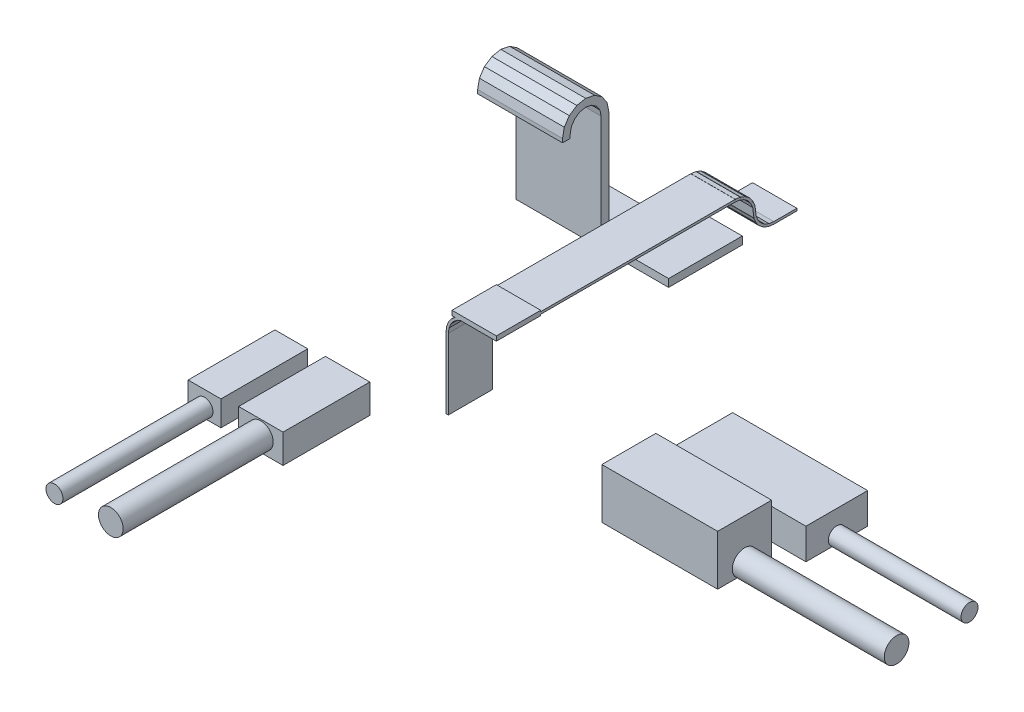
from build123d import *

# Parameters (mm, degrees)
SKETCH1_W                   = 8.5
SKETCH1_H                   = 6.5
PLUG_USBC_DEPTH             = 22.5
SKETCH2_R                   = 2.2
CABLE_USBC_DEPTH            = 39.4
SKETCH3_W                   = 11.5
SKETCH3_H                   = 7.5
PLUG_HDMI_DEPTH             = 22.5
SKETCH4_R                   = 3.2
CABLE_HDMI_DEPTH            = 39.4
SKETCH5_W                   = 14
SKETCH5_H                   = 13
PLUG_ETH_DEPTH              = 30
SKETCH6_R                   = 3.2
CABLE_ETH_DEPTH             = 39.9
SKETCH7_W                   = 16
SKETCH7_H                   = 8
PLUG_USBA_DEPTH             = 35
SKETCH8_R                   = 2.2
CABLE_USBA_DEPTH            = 34.9
SKETCH9_W                   = 6
SKETCH9_H                   = 0.6
RIBBON_0_DEPTH              = 11.5
RIBBON_1_DEPTH              = 11.5
RIBBON_2_DEPTH              = 11.5
RIBBON_3_DEPTH              = 11.5
RIBBON_4_DEPTH              = 11.5
RIBBON_5_DEPTH              = 11.5
RIBBON_6_DEPTH              = 11.5
RIBBON_7_DEPTH              = 11.5
RIBBON_8_DEPTH              = 11.5
RIBBON_9_DEPTH              = 11.5
RIBBON_10_DEPTH             = 11.5
RIBBON_11_DEPTH             = 11.5
RIBBON_12_DEPTH             = 11.5
SKETCH22_W                  = 56.15
SKETCH22_H                  = 0.6
RIBBON_13_DEPTH             = 11.5
SKETCH23_W                  = 11.5
SKETCH23_H                  = 11.5
RIBBON_FOLD_DEPTH           = 1.2
SKETCH24_W                  = 2
SKETCH24_H                  = 0.6
RIBBON_14_DEPTH             = 11.5
RIBBON_15_DEPTH             = 11.5
RIBBON_16_DEPTH             = 11.5
RIBBON_17_DEPTH             = 11.5
RIBBON_18_DEPTH             = 11.5
RIBBON_19_DEPTH             = 11.5
RIBBON_20_DEPTH             = 11.5
SKETCH31_W                  = 0.6
SKETCH31_H                  = 18.39
RIBBON_21_DEPTH             = 11.5
SKETCH32_W                  = 10
SKETCH32_H                  = 6
JUMPERS_WINDOW_DEPTH        = 2
SKETCH33_W                  = 39.5
SKETCH33_H                  = 13.1
JUMPERS_ACROSS_DEPTH        = 2
SKETCH34_W                  = 2
SKETCH34_H                  = 29.7
JUMPERS_RISE_DEPTH          = 22
JUMPERS_HAIRPIN_DEPTH       = 22
SKETCH36_W                  = 2
SKETCH36_H                  = 0.99
JUMPERS_INTO_HOUSINGS_DEPTH = 22


with BuildPart() as part:
    # Sketch1 → Plug usbc (new body)
    with BuildSketch(Plane.XY.offset(93)):
        with Locations((-43.8, -14.8)):
            Rectangle(SKETCH1_W, SKETCH1_H)
    extrude(amount=PLUG_USBC_DEPTH)

    # Sketch2 → Cable usbc (add)
    with BuildSketch(Plane.XY.offset(115)):
        with Locations((-43.8, -15.5)):
            Circle(SKETCH2_R)
    extrude(amount=CABLE_USBC_DEPTH)


with BuildPart() as body_2:
    # Sketch3 → Plug hdmi (new body)
    with BuildSketch(Plane.XY.offset(93)):
        with Locations((-29.2, -14.7)):
            Rectangle(SKETCH3_W, SKETCH3_H)
    extrude(amount=PLUG_HDMI_DEPTH)

    # Sketch4 → Cable hdmi (add)
    with BuildSketch(Plane.XY.offset(115)):
        with Locations((-29.2, -14.5)):
            Circle(SKETCH4_R)
    extrude(amount=CABLE_HDMI_DEPTH)


with BuildPart() as body_3:
    # Sketch5 → Plug eth (new body)
    with BuildSketch(Plane(origin=(33, 0, 0), x_dir=(0, 0, -1), z_dir=(1, 0, 0))):
        with Locations((-82.3, -9.6)):
            Rectangle(SKETCH5_W, SKETCH5_H)
    extrude(amount=PLUG_ETH_DEPTH)

    # Sketch6 → Cable eth (add)
    with BuildSketch(Plane(origin=(62.5, 0, 0), x_dir=(0, 0, -1), z_dir=(1, 0, 0))):
        with Locations((-82.3, -13.5)):
            Circle(SKETCH6_R)
    extrude(amount=CABLE_ETH_DEPTH)


with BuildPart() as body_4:
    # Sketch7 → Plug usba (new body)
    with BuildSketch(Plane(origin=(33, 0, 0), x_dir=(0, 0, -1), z_dir=(1, 0, 0))):
        with Locations((-63.4, -12.4)):
            Rectangle(SKETCH7_W, SKETCH7_H)
    extrude(amount=PLUG_USBA_DEPTH)

    # Sketch8 → Cable usba (add)
    with BuildSketch(Plane(origin=(67.5, 0, 0), x_dir=(0, 0, -1), z_dir=(1, 0, 0))):
        with Locations((-63.4, -14.5)):
            Circle(SKETCH8_R)
    extrude(amount=CABLE_USBA_DEPTH)


with BuildPart() as body_5:
    # Sketch9 → Ribbon 0 (new body)
    with BuildSketch(Plane(origin=(-5.35, 0, 0), x_dir=(0, 0, -1), z_dir=(1, 0, 0))):
        with Locations((-14.9, 2)):
            Rectangle(SKETCH9_W, SKETCH9_H)
    extrude(amount=RIBBON_0_DEPTH)

    # Sketch10 → Ribbon 1 (add)
    with BuildSketch(Plane(origin=(-5.35, 0, 0), x_dir=(0, 0, -1), z_dir=(1, 0, 0))):
        Polygon((-17.939157858, 1.702566542), (-19.233253083, 1.87293741), (-19.154937368, 2.467804327), (-17.860842142, 2.297433458), align=None)
    extrude(amount=RIBBON_1_DEPTH)

    # Sketch11 → Ribbon 2 (add)
    with BuildSketch(Plane(origin=(-5.35, 0, 0), x_dir=(0, 0, -1), z_dir=(1, 0, 0))):
        Polygon((-19.308900255, 1.893207009), (-20.51480503, 2.392709121), (-20.28519497, 2.947036841), (-19.079290196, 2.447534728), align=None)
    extrude(amount=RIBBON_2_DEPTH)

    # Sketch12 → Ribbon 3 (add)
    with BuildSketch(Plane(origin=(-5.35, 0, 0), x_dir=(0, 0, -1), z_dir=(1, 0, 0))):
        Polygon((-20.582628429, 2.431866979), (-21.618162335, 3.226460092), (-21.252905477, 3.702472096), (-20.217371571, 2.907878983), align=None)
    extrude(amount=RIBBON_3_DEPTH)

    # Sketch13 → Ribbon 4 (add)
    with BuildSketch(Plane(origin=(-5.35, 0, 0), x_dir=(0, 0, -1), z_dir=(1, 0, 0))):
        Polygon((-21.673539908, 3.281837665), (-22.468133021, 4.317371571), (-21.992121017, 4.682628429), (-21.197527904, 3.647094523), align=None)
    extrude(amount=RIBBON_4_DEPTH)

    # Sketch14 → Ribbon 5 (add)
    with BuildSketch(Plane(origin=(-5.35, 0, 0), x_dir=(0, 0, -1), z_dir=(1, 0, 0))):
        Polygon((-22.507290879, 4.38519497), (-23.006792991, 5.591099745), (-22.452465272, 5.820709804), (-21.952963159, 4.61480503), align=None)
    extrude(amount=RIBBON_5_DEPTH)

    # Sketch15 → Ribbon 6 (add)
    with BuildSketch(Plane(origin=(-5.35, 0, 0), x_dir=(0, 0, -1), z_dir=(1, 0, 0))):
        Polygon((-23.02706259, 5.666746917), (-23.197433458, 6.960842142), (-22.602566542, 7.039157858), (-22.432195673, 5.745062632), align=None)
    extrude(amount=RIBBON_6_DEPTH)

    # Sketch16 → Ribbon 7 (add)
    with BuildSketch(Plane(origin=(-5.35, 0, 0), x_dir=(0, 0, -1), z_dir=(1, 0, 0))):
        Polygon((-23.197433458, 6.960842142), (-23.367804327, 8.254937368), (-22.77293741, 8.333253083), (-22.602566542, 7.039157858), align=None)
    extrude(amount=RIBBON_7_DEPTH)

    # Sketch17 → Ribbon 8 (add)
    with BuildSketch(Plane(origin=(-5.35, 0, 0), x_dir=(0, 0, -1), z_dir=(1, 0, 0))):
        Polygon((-23.347534728, 8.179290196), (-23.847036841, 9.38519497), (-23.292709121, 9.61480503), (-22.793207009, 8.408900255), align=None)
    extrude(amount=RIBBON_8_DEPTH)

    # Sketch18 → Ribbon 9 (add)
    with BuildSketch(Plane(origin=(-5.35, 0, 0), x_dir=(0, 0, -1), z_dir=(1, 0, 0))):
        Polygon((-23.807878983, 9.317371571), (-24.602472096, 10.352905477), (-24.126460092, 10.718162335), (-23.331866979, 9.682628429), align=None)
    extrude(amount=RIBBON_9_DEPTH)

    # Sketch19 → Ribbon 10 (add)
    with BuildSketch(Plane(origin=(-5.35, 0, 0), x_dir=(0, 0, -1), z_dir=(1, 0, 0))):
        Polygon((-24.547094523, 10.297527904), (-25.582628429, 11.092121017), (-25.217371571, 11.568133021), (-24.181837665, 10.773539908), align=None)
    extrude(amount=RIBBON_10_DEPTH)

    # Sketch20 → Ribbon 11 (add)
    with BuildSketch(Plane(origin=(-5.35, 0, 0), x_dir=(0, 0, -1), z_dir=(1, 0, 0))):
        Polygon((-25.51480503, 11.052963159), (-26.720709804, 11.552465272), (-26.491099745, 12.106792991), (-25.28519497, 11.607290879), align=None)
    extrude(amount=RIBBON_11_DEPTH)

    # Sketch21 → Ribbon 12 (add)
    with BuildSketch(Plane(origin=(-5.35, 0, 0), x_dir=(0, 0, -1), z_dir=(1, 0, 0))):
        Polygon((-26.645062632, 11.532195673), (-27.939157858, 11.702566542), (-27.860842142, 12.297433458), (-26.566746917, 12.12706259), align=None)
    extrude(amount=RIBBON_12_DEPTH)

    # Sketch22 → Ribbon 13 (add)
    with BuildSketch(Plane(origin=(-5.35, 0, 0), x_dir=(0, 0, -1), z_dir=(1, 0, 0))):
        with Locations((-55.975, 12)):
            Rectangle(SKETCH22_W, SKETCH22_H)
    extrude(amount=RIBBON_13_DEPTH)

    # Sketch23 → Ribbon Fold (add)
    with BuildSketch(Plane(origin=(0, 11.4, 0), x_dir=(1, 0, 0), z_dir=(0, 1, 0))):
        with Locations((0.4, -84.05)):
            Rectangle(SKETCH23_W, SKETCH23_H)
    extrude(amount=RIBBON_FOLD_DEPTH)

    # Sketch24 → Ribbon 14 (add)
    with BuildSketch(Plane.XY.offset(78.3)):
        with Locations((-0.6, 12)):
            Rectangle(SKETCH24_W, SKETCH24_H)
    extrude(amount=RIBBON_14_DEPTH)

    # Sketch25 → Ribbon 15 (add)
    with BuildSketch(Plane.XY.offset(78.3)):
        Polygon((-1.560842142, 11.702566542), (-2.854937368, 11.532195673), (-2.933253083, 12.12706259), (-1.639157858, 12.297433458), align=None)
    extrude(amount=RIBBON_15_DEPTH)

    # Sketch26 → Ribbon 16 (add)
    with BuildSketch(Plane.XY.offset(78.3)):
        Polygon((-2.779290196, 11.552465272), (-3.98519497, 11.052963159), (-4.21480503, 11.607290879), (-3.008900255, 12.106792991), align=None)
    extrude(amount=RIBBON_16_DEPTH)

    # Sketch27 → Ribbon 17 (add)
    with BuildSketch(Plane.XY.offset(78.3)):
        Polygon((-3.917371571, 11.092121017), (-4.952905477, 10.297527904), (-5.318162335, 10.773539908), (-4.282628429, 11.568133021), align=None)
    extrude(amount=RIBBON_17_DEPTH)

    # Sketch28 → Ribbon 18 (add)
    with BuildSketch(Plane.XY.offset(78.3)):
        Polygon((-4.897527904, 10.352905477), (-5.692121017, 9.317371571), (-6.168133021, 9.682628429), (-5.373539908, 10.718162335), align=None)
    extrude(amount=RIBBON_18_DEPTH)

    # Sketch29 → Ribbon 19 (add)
    with BuildSketch(Plane.XY.offset(78.3)):
        Polygon((-5.652963159, 9.38519497), (-6.152465272, 8.179290196), (-6.706792991, 8.408900255), (-6.207290879, 9.61480503), align=None)
    extrude(amount=RIBBON_19_DEPTH)

    # Sketch30 → Ribbon 20 (add)
    with BuildSketch(Plane.XY.offset(78.3)):
        Polygon((-6.132195673, 8.254937368), (-6.302566542, 6.960842142), (-6.897433458, 7.039157858), (-6.72706259, 8.333253083), align=None)
    extrude(amount=RIBBON_20_DEPTH)

    # Sketch31 → Ribbon 21 (add)
    with BuildSketch(Plane.XY.offset(78.3)):
        with Locations((-6.6, -2.195)):
            Rectangle(SKETCH31_W, SKETCH31_H)
    extrude(amount=RIBBON_21_DEPTH)


with BuildPart() as body_6:
    # Sketch32 → Jumpers Window (new body)
    with BuildSketch(Plane(origin=(0, -13, 0), x_dir=(1, 0, 0), z_dir=(0, 1, 0))):
        with Locations((-13, -14.9)):
            Rectangle(SKETCH32_W, SKETCH32_H)
    extrude(amount=JUMPERS_WINDOW_DEPTH)

    # Sketch33 → Jumpers Across (add)
    with BuildSketch(Plane(origin=(0, -13, 0), x_dir=(1, 0, 0), z_dir=(0, 1, 0))):
        with Locations((-27.75, -24.45)):
            Rectangle(SKETCH33_W, SKETCH33_H)
    extrude(amount=JUMPERS_ACROSS_DEPTH)

    # Sketch34 → Jumpers Rise (add)
    with BuildSketch(Plane(origin=(-47.5, 0, 0), x_dir=(0, 0, -1), z_dir=(1, 0, 0))):
        with Locations((-30, 1.85)):
            Rectangle(SKETCH34_W, SKETCH34_H)
    extrude(amount=JUMPERS_RISE_DEPTH)

    # Sketch35 → Jumpers Hairpin (add)
    with BuildSketch(Plane(origin=(-47.5, 0, 0), x_dir=(0, 0, -1), z_dir=(1, 0, 0))):
        Polygon((-29, 16.7), (-29.456722805, 18.996100594), (-30.757359313, 20.942640687), (-32.703899406, 22.243277195), (-35, 22.7), (-37.296100594, 22.243277195), (-39.242640687, 20.942640687), (-40.543277195, 18.996100594), (-41, 16.7), (-39, 16.7), (-38.69551813, 18.230733729), (-37.828427125, 19.528427125), (-36.530733729, 20.39551813), (-35, 20.7), (-33.469266271, 20.39551813), (-32.171572875, 19.528427125), (-31.30448187, 18.230733729), (-31, 16.7), align=None)
    extrude(amount=JUMPERS_HAIRPIN_DEPTH)

    # Sketch36 → Jumpers Into Housings (add)
    with BuildSketch(Plane(origin=(-47.5, 0, 0), x_dir=(0, 0, -1), z_dir=(1, 0, 0))):
        with Locations((-40, 16.205)):
            Rectangle(SKETCH36_W, SKETCH36_H)
    extrude(amount=JUMPERS_INTO_HOUSINGS_DEPTH)


solid = Compound([part.part, body_2.part, body_3.part, body_4.part, body_5.part, body_6.part])
